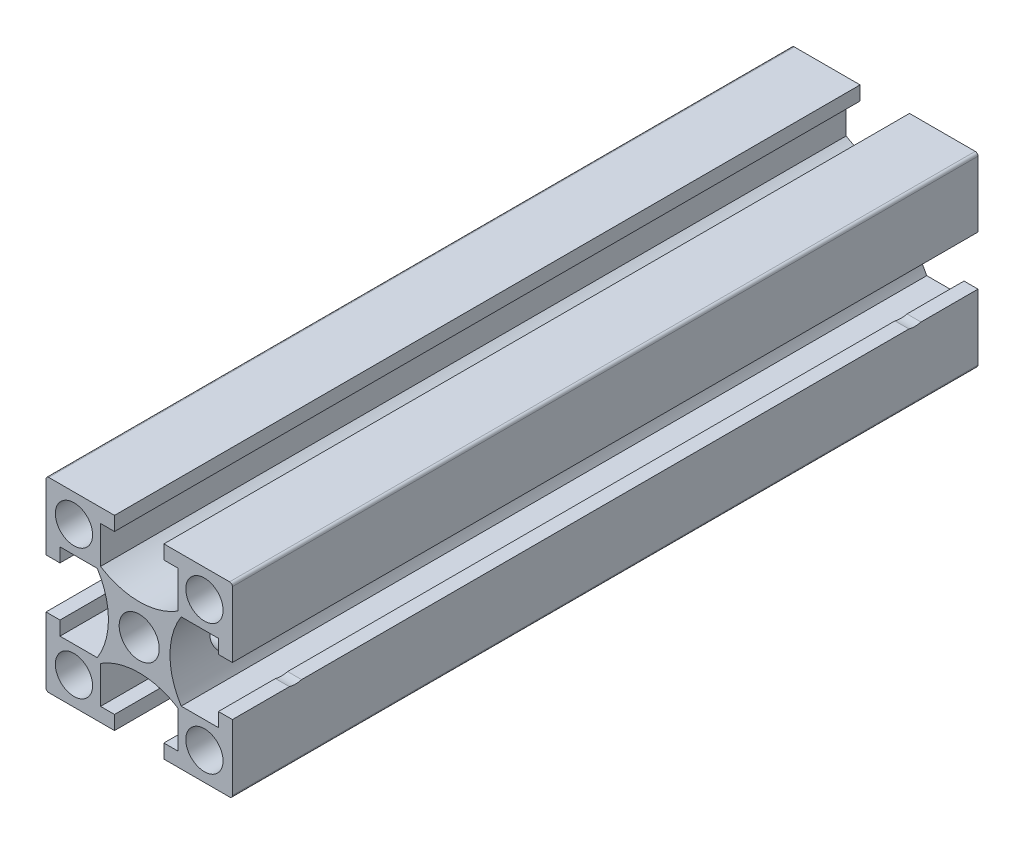
from build123d import *

# Parameters (mm, degrees)
SKETCH_1_W               = 20
SKETCH_1_H               = 20
SKETCH_1_R               = 2
SKETCH_1_R_2             = 2.15
EXTRUDE_1_DEPTH          = 80
CUT_EXTRUDE_1_REACH      = 83.24
PATTERN_CIRCULAR_1_COUNT = 4
FILLET_1_R               = 0.3
SKETCH_3_R               = 2.5
CUT_EXTRUDE_2_DEPTH      = 84.066238629
SKETCH_4_R               = 2.5
CUT_EXTRUDE_4_DEPTH      = 84.066238725


with BuildPart() as part:
    # 스케치1 → 보스-돌출1 (new body)
    with BuildSketch(Plane.XY):
        Rectangle(SKETCH_1_W, SKETCH_1_H)
        with Locations((-7, -7)):
            Circle(SKETCH_1_R, mode=Mode.SUBTRACT)
        with Locations((7, -7)):
            Circle(SKETCH_1_R, mode=Mode.SUBTRACT)
        with Locations((-7, 7)):
            Circle(SKETCH_1_R, mode=Mode.SUBTRACT)
        Circle(SKETCH_1_R_2, mode=Mode.SUBTRACT)
        with Locations((7, 7)):
            Circle(SKETCH_1_R, mode=Mode.SUBTRACT)
    extrude(amount=EXTRUDE_1_DEPTH)

    # 스케치1<3> → 컷-돌출1 (cut, up to next)
    with BuildSketch(Plane.XY, mode=Mode.PRIVATE) as cut_extrude_1_sk1:
        with BuildLine():
            Line((-8.5, 2.65), (-10, 2.65))
            Line((-10, 2.65), (-10, -2.65))
            Line((-10, -2.65), (-8.5, -2.65))
            Line((-8.5, -2.65), (-8.5, -4.15))
            Line((-8.5, -4.15), (-4.503166667, -4.15))
            ThreePointArc((-4.503166667, -4.15), (-3.3, 0), (-4.503166667, 4.15))
            Line((-4.503166667, 4.15), (-8.5, 4.15))
            Line((-8.5, 4.15), (-8.5, 2.65))
        make_face()
    cut_extrude_1_tool1 = extrude(cut_extrude_1_sk1.sketch, amount=CUT_EXTRUDE_1_REACH, mode=Mode.PRIVATE) & part.part
    cut_extrude_1 = cut_extrude_1_tool1.solids().sort_by_distance((-6.606913, 0, 0))[0]
    add(cut_extrude_1, mode=Mode.SUBTRACT)

    # 원형 패턴1: 컷-돌출1 ×4 about axis
    pattern_circular_1_axis = Axis((0, 0, 80), (0, 0, -1))
    for i in range(1, PATTERN_CIRCULAR_1_COUNT):
        add(cut_extrude_1.rotate(pattern_circular_1_axis, i * 360 / PATTERN_CIRCULAR_1_COUNT), mode=Mode.SUBTRACT)

    # 필렛1
    fillet_1_edges = [part.edges().sort_by_distance(p)[0] for p in [
        (10, -10, 40),
        (-10, -10, 40),
        (-10, 10, 40),
        (10, 10, 40),
    ]]
    fillet(fillet_1_edges, radius=FILLET_1_R)

    # 스케치3 → 컷-돌출2 (cut, through all)
    with BuildSketch(Plane.XZ.offset(10)):
        with Locations((0, 70)):
            Circle(SKETCH_3_R)
    extrude(amount=-CUT_EXTRUDE_2_DEPTH, mode=Mode.SUBTRACT)

    # 스케치4 → 컷-돌출4 (cut, through all)
    with BuildSketch(Plane.ZY.offset(10)):
        with Locations((6.765041698, -0.235340817)):
            Circle(SKETCH_4_R)
        with Locations((73.233079103, -0.237220017)):
            Circle(SKETCH_4_R)
    extrude(amount=-CUT_EXTRUDE_4_DEPTH, mode=Mode.SUBTRACT)


solid = part.part
